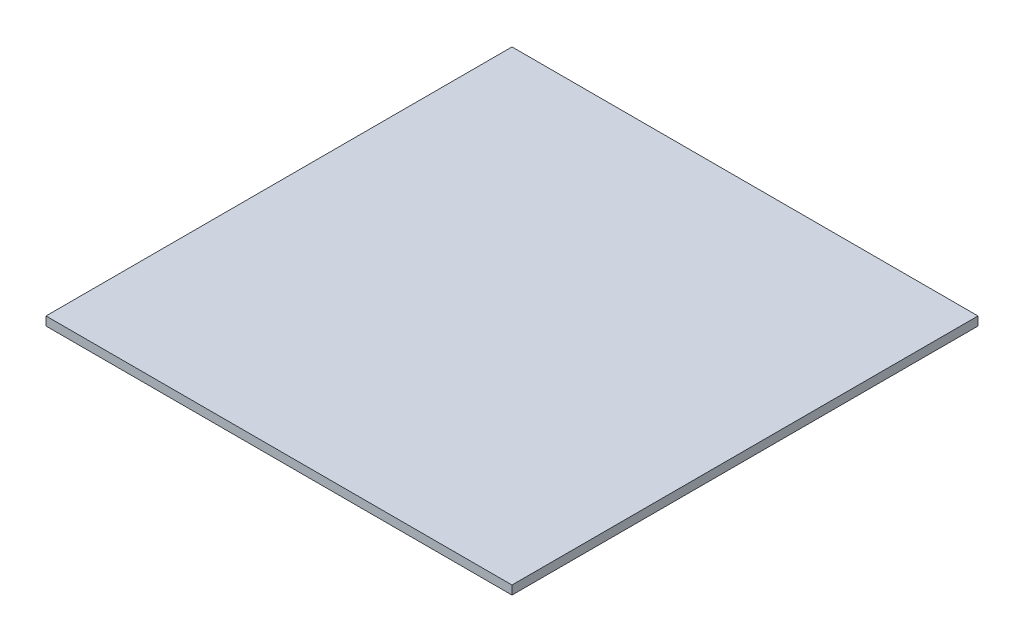
from build123d import *

# Parameters (mm, degrees)
SKETCH1_W           = 609.6
SKETCH1_H           = 609.6
BOSS_EXTRUDE1_DEPTH = 11.4554


with BuildPart() as part:
    # Sketch1 → Boss-Extrude1 (new body)
    with BuildSketch(Plane(origin=(0, 0, 0), x_dir=(1, 0, 0), z_dir=(0, 1, 0))):
        Rectangle(SKETCH1_W, SKETCH1_H)
    extrude(amount=BOSS_EXTRUDE1_DEPTH)


solid = part.part
